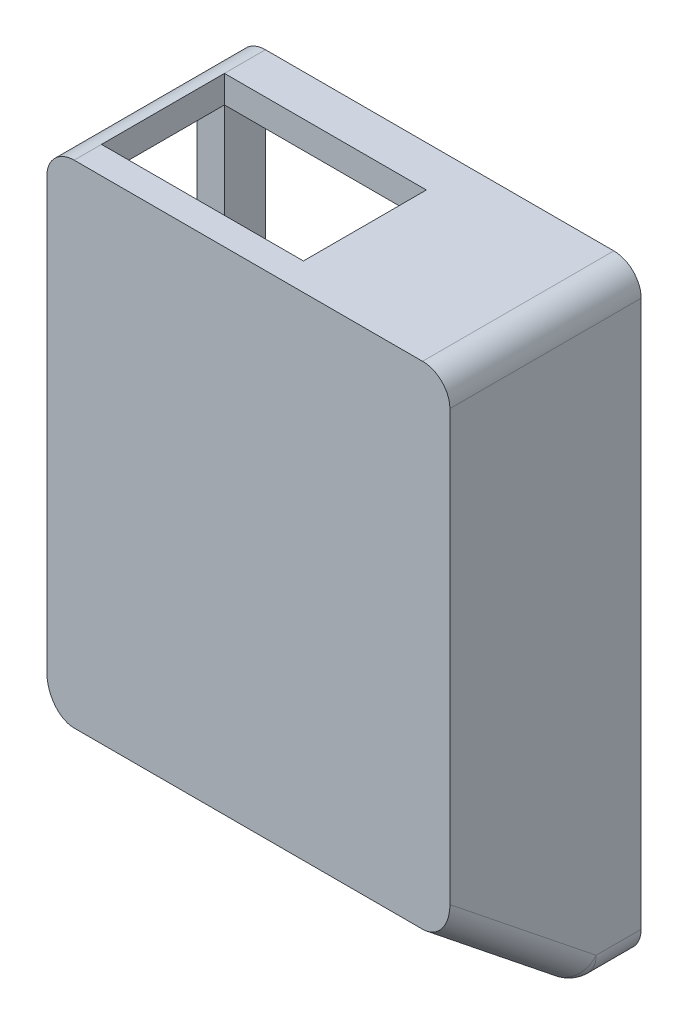
from build123d import *
from OCP.BRepFilletAPI import BRepFilletAPI_MakeChamfer

# Parameters (mm, degrees)
SKETCH1_W           = 29.5
SKETCH1_H           = 44
SKETCH1_W_2         = 25.5
SKETCH1_H_2         = 40
BOSS_EXTRUDE1_DEPTH = 12
BOSS_EXTRUDE2_START = 12
SKETCH1_2_W         = 29.5
SKETCH1_2_H         = 44
SKETCH1_2_W_2       = 25.5
SKETCH1_2_H_2       = 40
BOSS_EXTRUDE2_DEPTH = 2
BOSS_EXTRUDE3_DEPTH = 10.4
CUT_EXTRUDE1_REACH  = 50.472
SKETCH3_W           = 14.779376432
SKETCH3_H           = 9
CUT_EXTRUDE2_REACH  = 41.373
SKETCH4_W           = 9
SKETCH4_H           = 10.467816728
FILLET1_R           = 2
FILLET2_SIZE        = 8
FILLET2_SIZE2       = 10
SKETCH6_R           = 2
CUT_EXTRUDE3_DEPTH  = 8.4
FILLET3_R           = 5
FILLET5_R           = 2
FILLET6_R           = 2


with BuildPart() as part:
    # Sketch1 → Boss-Extrude1 (new body)
    with BuildSketch(Plane.XY):
        Rectangle(SKETCH1_W, SKETCH1_H)
        Rectangle(SKETCH1_W_2, SKETCH1_H_2, mode=Mode.SUBTRACT)
    extrude(amount=BOSS_EXTRUDE1_DEPTH)

    # Sketch1<2> → Boss-Extrude2 (add)
    # profile 1 of 2: a face of its own
    with BuildSketch(Plane.XY.offset(BOSS_EXTRUDE2_START)):
        Rectangle(SKETCH1_2_W, SKETCH1_2_H)
        Rectangle(SKETCH1_2_W_2, SKETCH1_2_H_2, mode=Mode.SUBTRACT)
    # profile 2 of 2: a face of its own
    with BuildSketch(Plane.XY.offset(BOSS_EXTRUDE2_START)):
        Rectangle(SKETCH1_2_W_2, SKETCH1_2_H_2)
    extrude(amount=BOSS_EXTRUDE2_DEPTH)

    # Sketch2 → Boss-Extrude3 (add)
    with BuildSketch(Plane(origin=(0, 0, 12), x_dir=(-1, 0, 0), z_dir=(0, 0, -1))):
        Polygon((-4.029376432, 20), (-4.029376432, 4.682180434), (-12.75, 4.682180434), (-12.75, -4.051886914), (-2.029376432, -4.051886914), (-2.029376432, 20), align=None)
    extrude(amount=BOSS_EXTRUDE3_DEPTH)

    # Sketch3 → Cut-Extrude1 (cut, up to next)
    with BuildSketch(Plane(origin=(0, 22, 0), x_dir=(1, 0, 0), z_dir=(0, 1, 0)), mode=Mode.PRIVATE) as cut_extrude1_sk1:
        with Locations((-5.360311784, -7.5)):
            Rectangle(SKETCH3_W, SKETCH3_H)
    cut_extrude1_tool1 = extrude(cut_extrude1_sk1.sketch, amount=-CUT_EXTRUDE1_REACH, mode=Mode.PRIVATE) & part.part
    add(cut_extrude1_tool1.solids().sort_by_distance((-5.360312, 22, 7.5))[0], mode=Mode.SUBTRACT)

    # Sketch4 → Cut-Extrude2 (cut, up to next)
    with BuildSketch(Plane.ZY.offset(14.75), mode=Mode.PRIVATE) as cut_extrude2_sk1:
        with Locations((7.5, 14.766091636)):
            Rectangle(SKETCH4_W, SKETCH4_H)
    cut_extrude2_tool1 = extrude(cut_extrude2_sk1.sketch, amount=-CUT_EXTRUDE2_REACH, mode=Mode.PRIVATE) & part.part
    add(cut_extrude2_tool1.solids().sort_by_distance((-14.75, 14.766092, 7.5))[0], mode=Mode.SUBTRACT)

    # Fillet1
    fillet1_edges = [part.edges().sort_by_distance(p)[0] for p in [
        (-14.75, 22, 7),
        (14.75, 22, 7),
    ]]
    fillet(fillet1_edges, radius=FILLET1_R - 0.0001)  # a hair under: the kernel refuses the full size

    # Fillet2: one chamfer whose edges measure the first distance from different faces: ONE call of the kernel's chamfer builder (chamfer() names one face for all edges)
    fillet2_edges_1 = [part.edges().sort_by_distance(p)[0] for p in [
        (0, -20, 12),
    ]]
    fillet2_side_1 = [part.faces().sort_by_distance(p)[0] for p in [
        (-2.893950715, -1.385908374, 12),
    ]]
    fillet2_edges_2 = [part.edges().sort_by_distance(p)[0] for p in [
        (0, -22, 14),
    ]]
    fillet2_side_2 = [part.faces().sort_by_distance(p)[0] for p in [
        (0, -0.028542601, 14),
    ]]
    fillet2 = BRepFilletAPI_MakeChamfer(part.part.solid().wrapped)
    for e in fillet2_edges_1:
        fillet2.Add(FILLET2_SIZE, FILLET2_SIZE2, e.wrapped, fillet2_side_1[0].wrapped)  # the first distance lies on this face
    for e in fillet2_edges_2:
        fillet2.Add(FILLET2_SIZE, FILLET2_SIZE2, e.wrapped, fillet2_side_2[0].wrapped)  # the first distance lies on this face
    add(Compound.cast(fillet2.Shape()), mode=Mode.REPLACE)

    # Sketch6 → Cut-Extrude3 (cut)
    with BuildSketch(Plane(origin=(0, 0, 1.6), x_dir=(-1, 0, 0), z_dir=(0, 0, -1))):
        with Locations((-7.7635572, 0)):
            Circle(SKETCH6_R)
    extrude(amount=-CUT_EXTRUDE3_DEPTH, mode=Mode.SUBTRACT)

    # Fillet3
    fillet3_edges = [part.edges().sort_by_distance(p)[0] for p in [
        (2.029376432, -4.051886914, 6.8),
    ]]
    fillet(fillet3_edges, radius=FILLET3_R)

    # Fillet5
    fillet5_edges = [part.edges().sort_by_distance(p)[0] for p in [
        (0, -22, 4),
    ]]
    fillet(fillet5_edges, radius=FILLET5_R)

    # Fillet6
    fillet6_edges = [part.edges().sort_by_distance(p)[0] for p in [
        (14.75, -17.780868809, 9.273913988),
        (14.75, -22, 1.649218941),
        (-14.75, -22, 1.649218941),
        (-14.75, -17.780868809, 9.273913988),
        (-14.75, -21.887256638, 3.960451764),
        (14.75, -21.887256638, 3.960451764),
    ]]
    fillet(fillet6_edges, radius=FILLET6_R)


solid = part.part
